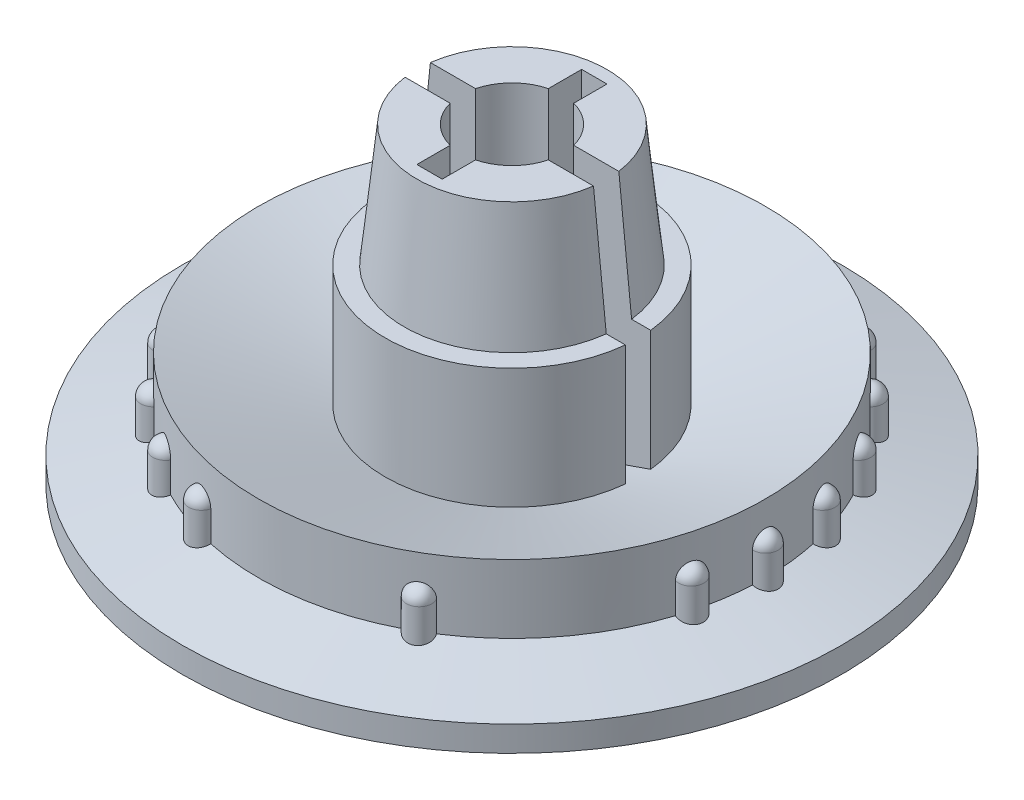
from build123d import *
from build123d.topology import SkipClean

# Parameters (mm, degrees)
SKETCH_1_R                    = 13
EXTRUDE_1_DEPTH               = 2
SKETCH_2_R                    = 10
EXTRUDE_2_DEPTH               = 2.5
CUT_EXTRUDE_1_DEPTH           = 12
CUT_EXTRUDE_2_REACH           = 24.12
SKETCH_6_R                    = 2
CUT_EXTRUDE_3_REACH           = 24.12
CHAMFER_1_SIZE                = 1
CHAMFER_1_SIZE_2              = 3.732050808
EXTRUDE_3_DEPTH               = 3
PATTERN_CIRCULAR_3_COUNT      = 24
CUT_REVOLVE_3_ANGLE           = 20
CUT_REVOLVE_3_OTHER_WAY_ANGLE = 5
CUT_REVOLVE_4_ANGLE           = 20
CUT_REVOLVE_4_OTHER_WAY_ANGLE = 5


with BuildPart() as part:
    # 草图1 → 凸台-拉伸1 (new body)
    with BuildSketch(Plane(origin=(0, 0, 0), x_dir=(1, 0, 0), z_dir=(0, 1, 0))):
        with Locations(Location((0, 0, 0), (0, 0, 270))):
            Circle(SKETCH_1_R)
    extrude(amount=EXTRUDE_1_DEPTH)

    # 草图2 → 凸台-拉伸2 (add)
    with BuildSketch(Plane(origin=(0, 2, 0), x_dir=(1, 0, 0), z_dir=(0, 1, 0))):
        with Locations(Location((0, 0, 0), (0, 0, 270))):
            Circle(SKETCH_2_R)
    extrude(amount=EXTRUDE_2_DEPTH)

    # 草图3 → 切除-旋转1 (revolve, cut)
    with BuildSketch(Plane.XY, mode=Mode.PRIVATE) as cut_revolve_1_sk:
        Polygon((0, 4.5), (0, 1), (10, 4.5), align=None)
    revolve(cut_revolve_1_sk.sketch.rotate(Axis((0, 4.5, 0), (0, -1, 0)), 90), axis=Axis((0, 4.5, 0), (0, -1, 0)), mode=Mode.SUBTRACT)

    # 草图4 → 旋转1 (revolve)
    with BuildSketch(Plane.XY, mode=Mode.PRIVATE) as revolve_1_sk:
        Polygon((0, 0), (5, 0), (5, 7.5), (4.25, 7.5), (3.75, 12.3), (0, 12.3), align=None)
    revolve(revolve_1_sk.sketch.rotate(Axis((0, 12.3, 0), (0, -1, 0)), 90), axis=Axis((0, 12.3, 0), (0, -1, 0)))

    # 草图5 → 切除-拉伸1 (cut)
    with BuildSketch(Plane(origin=(0, 12.3, 0), x_dir=(1, 0, 0), z_dir=(0, 1, 0))):
        with BuildLine():
            Line((-0.5, -1.936491673), (-0.5, -3.25))
            Line((-0.5, -3.25), (0.5, -3.25))
            Line((0.5, -3.25), (0.5, -1.936491673))
            ThreePointArc((0.5, -1.936491673), (2, 0), (0.5, 1.936491673))
            Line((0.5, 1.936491673), (0.5, 3.25))
            Line((0.5, 3.25), (-0.5, 3.25))
            Line((-0.5, 3.25), (-0.5, 1.936491673))
            ThreePointArc((-0.5, 1.936491673), (-2, 0), (-0.5, -1.936491673))
        make_face()
    extrude(amount=-CUT_EXTRUDE_1_DEPTH, mode=Mode.SUBTRACT)

    # 草图6 → 切除-拉伸2 (cut, up to next)
    with BuildSketch(Plane(origin=(0, 0, 0), x_dir=(-1, 0, 0), z_dir=(0, -1, 0)), mode=Mode.PRIVATE) as cut_extrude_2_sk1:
        with Locations(Location((0, 0, 0), (0, 0, 255.522487814))):
            Circle(SKETCH_6_R)
    cut_extrude_2_tool1 = extrude(cut_extrude_2_sk1.sketch, amount=-CUT_EXTRUDE_2_REACH, mode=Mode.PRIVATE) & part.part
    add(cut_extrude_2_tool1.solids().sort_by_distance((0, 0, 0))[0], mode=Mode.SUBTRACT)

    # 切除-拉伸3: up to this cone (the profile starts inside it)
    with SkipClean():  # the faces are left unmerged after this step: merging them gives an invalid solid
        cut_extrude_3_end = Plane(origin=(0, 12.3, 0), z_dir=(0, 1, 0)).offset(-11.299999) * Cone(2.857e-06, 194.873469388, 68.205713286, align=(Align.CENTER, Align.CENTER, Align.MIN), mode=Mode.PRIVATE)
        # 草图7 → 切除-拉伸3 (cut, up to the surface)
        with BuildSketch(Plane(origin=(0, 12.3, 0), x_dir=(1, 0, 0), z_dir=(0, 1, 0)), mode=Mode.PRIVATE) as cut_extrude_3_sk1:
            with BuildLine():
                Line((-4.974937186, 0.5), (4.974937186, 0.5))
                ThreePointArc((4.974937186, 0.5), (5, 0), (4.974937186, -0.5))
                Line((4.974937186, -0.5), (-4.974937186, -0.5))
                ThreePointArc((-4.974937186, -0.5), (-5, 0), (-4.974937186, 0.5))
            make_face()
        cut_extrude_3_tool1 = extrude(cut_extrude_3_sk1.sketch, amount=-CUT_EXTRUDE_3_REACH, mode=Mode.PRIVATE) & cut_extrude_3_end
        add(cut_extrude_3_tool1.solids().sort_by_distance((0, 12.3, 0))[0], mode=Mode.SUBTRACT)

    # 倒角1
    # the kernel refuses this chamfer: 3.732050808, 1 mm, written as the material it takes off along each edge
    with BuildSketch(Plane(origin=(0, 2, 0), x_dir=(0, 0, 1), z_dir=(-1, 0, 0))) as chamfer_1_piece_1_section:
        Polygon((13, -CHAMFER_1_SIZE), (13 - CHAMFER_1_SIZE_2, 0), (13, 0), align=None)
    chamfer_1_piece_1 = revolve(axis=Axis((0, 2, 0), (0, 1, 0)), mode=Mode.PRIVATE)
    chamfer_1_piece_1 = chamfer_1_piece_1 - Plane(origin=(0, 1.434827916, 0), x_dir=(0, 0, 1), z_dir=(0, -1, 0)) * Cylinder(10, 52, mode=Mode.PRIVATE)
    add(chamfer_1_piece_1, mode=Mode.SUBTRACT)

    # 草图8 → 凸台-拉伸3 (add)
    with BuildSketch(Plane(origin=(0, 0, 0), x_dir=(1, 0, 0), z_dir=(0, 1, 0))):
        with BuildLine():
            ThreePointArc((0.499843726, 9.9875), (0, 10.5), (-0.499843726, 9.9875))
            ThreePointArc((-0.499843726, 9.9875), (0, 10), (0.499843726, 9.9875))
        make_face()
    extrude_3 = extrude(amount=EXTRUDE_3_DEPTH)

    # 草图9 → 旋转2 (revolve)
    with BuildSketch(Plane(origin=(0, 0, 0), x_dir=(0, 0, -1), z_dir=(1, 0, 0))):
        with BuildLine():
            Line((10, 3.5), (10, 3))
            Line((10, 3), (10.5, 3))
            ThreePointArc((10.5, 3), (10.353553391, 3.353553391), (10, 3.5))
        make_face()
    revolve_2 = revolve(axis=Axis((0, 3.5, -10), (0, -1, 0)))

    # 阵列(圆周)3: 凸台-拉伸3, 旋转2 ×24 about axis
    pattern_circular_3_axis = Axis((0, 0, 0), (0, 1, 0))
    add([extrude_3.rotate(pattern_circular_3_axis, i * 360 / PATTERN_CIRCULAR_3_COUNT) for i in range(1, PATTERN_CIRCULAR_3_COUNT)])
    add([revolve_2.rotate(pattern_circular_3_axis, i * 360 / PATTERN_CIRCULAR_3_COUNT) for i in range(1, PATTERN_CIRCULAR_3_COUNT)])

    # 草图11 → 切除-旋转3 (revolve, cut)
    with BuildSketch(Plane(origin=(0, 0, 0), x_dir=(-0.7071067811865477, 0, -0.7071067811865475), z_dir=(0.7071067811865475, 0, -0.7071067811865477))):
        Polygon((-10, 4.5), (-10, 1.803847577), (-13, 1), align=None)
        Polygon((10, 4.5), (13, 1), (10, 1.803847577), align=None)
    revolve(axis=Axis((0, -1.010620127, 0), (0, 1, 0)), revolution_arc=CUT_REVOLVE_3_ANGLE, mode=Mode.SUBTRACT)

    # 草图11 → 切除-旋转3 other way (revolve, cut)
    with BuildSketch(Plane(origin=(0, 0, 0), x_dir=(-0.7071067811865477, 0, -0.7071067811865475), z_dir=(0.7071067811865475, 0, -0.7071067811865477))):
        Polygon((-10, 4.5), (-10, 1.803847577), (-13, 1), align=None)
        Polygon((10, 4.5), (13, 1), (10, 1.803847577), align=None)
    revolve(axis=Axis((0, -1.010620127, 0), (0, -1, 0)), revolution_arc=CUT_REVOLVE_3_OTHER_WAY_ANGLE, mode=Mode.SUBTRACT)

    # 草图12 → 切除-旋转4 (revolve, cut)
    with BuildSketch(Plane(origin=(0, 0, 0), x_dir=(0, 0, -1), z_dir=(1, 0, 0))):
        Polygon((-10, 4.5), (-10, 1.803847577), (-13, 1), align=None)
        Polygon((10, 4.5), (13, 1), (10, 1.803847577), align=None)
    revolve(axis=Axis((0, -0.794993112, 0), (0, 1, 0)), revolution_arc=CUT_REVOLVE_4_ANGLE, mode=Mode.SUBTRACT)

    # 草图12 → 切除-旋转4 other way (revolve, cut)
    with BuildSketch(Plane(origin=(0, 0, 0), x_dir=(0, 0, -1), z_dir=(1, 0, 0))):
        Polygon((-10, 4.5), (-10, 1.803847577), (-13, 1), align=None)
        Polygon((10, 4.5), (13, 1), (10, 1.803847577), align=None)
    revolve(axis=Axis((0, -0.794993112, 0), (0, -1, 0)), revolution_arc=CUT_REVOLVE_4_OTHER_WAY_ANGLE, mode=Mode.SUBTRACT)


solid = part.part
